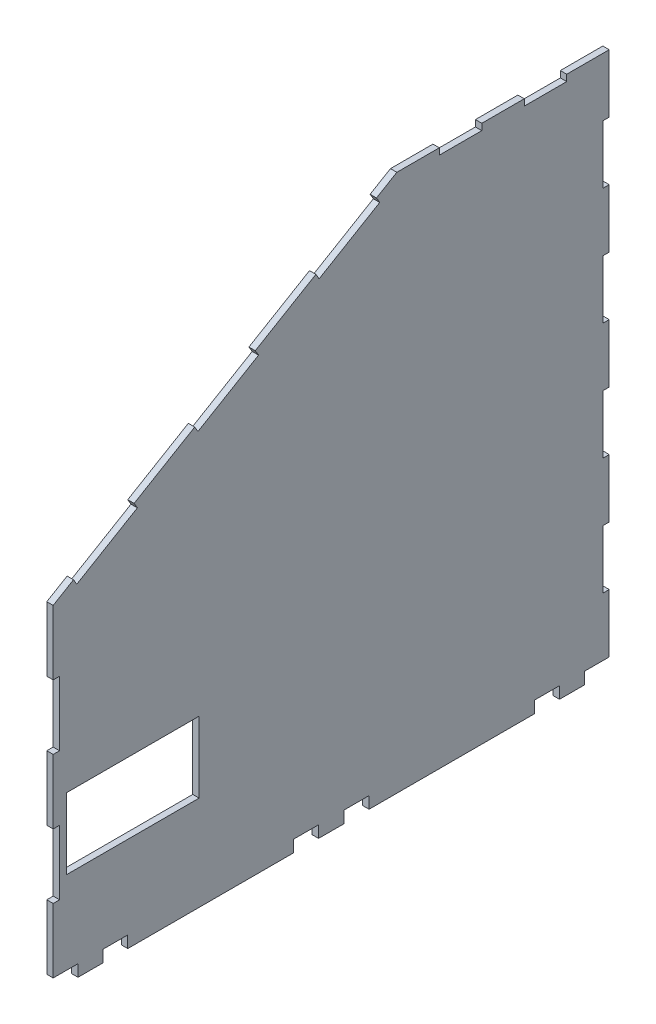
from build123d import *

# Parameters (mm, degrees)
SKETCH1_W           = 56
SKETCH1_H           = 30
BOSS_EXTRUDE1_DEPTH = 2.7


with BuildPart() as part:
    # Sketch1 → Boss-Extrude1 (new body)
    with BuildSketch(Plane(origin=(0, 0, 0), x_dir=(0, 0, -1), z_dir=(1, 0, 0))):
        Polygon((117.52, 87.8), (117.52, 112.5), (99.566, 112.5), (99.566, 109.8), (81.612, 109.8), (81.612, 112.5), (63.658, 112.5), (63.658, 109.8), (45.704, 109.8), (45.704, 112.5), (27.75, 112.5), (19.142256818, 107.410131897), (20.516521206, 105.086041238), (-5.094381521, 89.941988479), (-6.468645909, 92.266079138), (-32.079548636, 77.122026379), (-30.705284249, 74.79793572), (-56.316186976, 59.653882961), (-57.690451364, 61.977973621), (-83.301354091, 46.833920862), (-81.927089703, 44.509830203), (-107.53799243, 29.365777444), (-108.912256818, 31.689868103), (-117.52, 26.6), (-117.52, -0.68), (-114.82, -0.68), (-114.82, -27.96), (-117.52, -27.96), (-117.52, -55.24), (-114.82, -55.24), (-114.82, -82.52), (-117.52, -82.52), (-117.52, -109.8), (-107.013333333, -109.8), (-107.013333333, -112.5), (-107.013333333, -114.8), (-96.506666667, -114.8), (-96.506666667, -112.5), (-96.506666667, -109.8), (-86, -109.8), (-86, -112.5), (-86, -114.8), (-16, -114.8), (-16, -112.5), (-16, -109.8), (-5.333333333, -109.8), (-5.333333333, -112.5), (-5.333333333, -114.8), (5.333333333, -114.8), (5.333333333, -112.5), (5.333333333, -109.8), (16, -109.8), (16, -112.5), (16, -114.8), (86, -114.8), (86, -112.5), (86, -109.8), (96.506666667, -109.8), (96.506666667, -112.5), (96.506666667, -114.8), (107.013333333, -114.8), (107.013333333, -112.5), (107.013333333, -109.8), (117.52, -109.8), (117.52, -85.1), (114.82, -85.1), (114.82, -60.4), (117.52, -60.4), (117.52, -35.7), (114.82, -35.7), (114.82, -11), (117.52, -11), (117.52, 13.7), (114.82, 13.7), (114.82, 38.4), (117.52, 38.4), (117.52, 63.1), (114.82, 63.1), (114.82, 87.8), align=None)
        with Locations((-83.82, -59.8)):
            Rectangle(SKETCH1_W, SKETCH1_H, mode=Mode.SUBTRACT)
    extrude(amount=BOSS_EXTRUDE1_DEPTH)


solid = part.part
